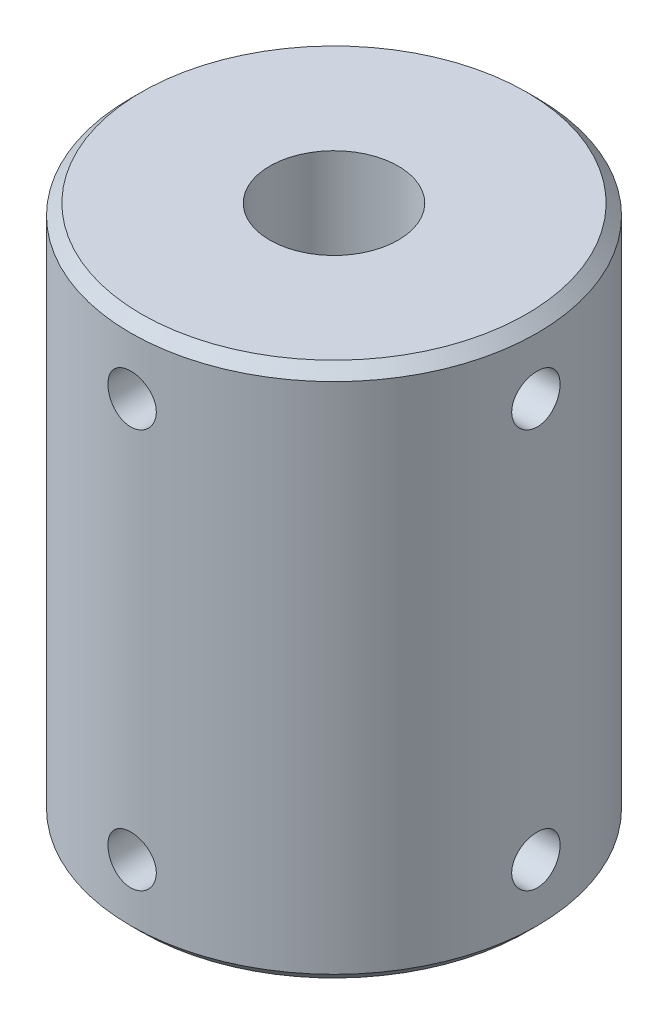
from build123d import *

# Parameters (mm, degrees)
SKETCH1_R                      = 9.5
BOSS_EXTRUDE1_DEPTH            = 25
CHAMFER1_SIZE                  = 0.508
F_6_0MM_DOWEL_HOLE1_D          = 6
SKETCH7_W                      = 1.1303
SKETCH7_H                      = 9.5
F_4_40_TAPPED_HOLE1_AT_2_COUNT = 2
F_4_40_TAPPED_HOLE1_AT_2_PITCH = 18.65
SKETCH10_W                     = 1.1303
SKETCH10_H                     = 9.5
F_4_40_TAPPED_HOLE2_AT_2_COUNT = 2
F_4_40_TAPPED_HOLE2_AT_2_PITCH = 18.65


with BuildPart() as part:
    # Sketch1 → Boss-Extrude1 (new body)
    with BuildSketch(Plane(origin=(0, 0, 0), x_dir=(1, 0, 0), z_dir=(0, 1, 0))):
        Circle(SKETCH1_R)
    extrude(amount=BOSS_EXTRUDE1_DEPTH)

    # Chamfer1
    chamfer1_edges = [part.edges().sort_by_distance(p)[0] for p in [
        (-9.5, 0, 0),
        (-9.5, 25, 0),
    ]]
    chamfer(chamfer1_edges, length=CHAMFER1_SIZE)

    # Ø6.0mm Dowel Hole1 (through all)
    with Locations(Plane(origin=(0, 25, 0), x_dir=(1, 0, 0), z_dir=(0, 1, 0))):
        with Locations((0, 0)):
            Hole(F_6_0MM_DOWEL_HOLE1_D / 2)

    # Sketch7 → #4-40 Tapped Hole1 (revolve, cut)
    with BuildSketch(Plane.ZX.offset(21.825)):
        with Locations((0.56515, 4.75)):
            Rectangle(SKETCH7_W, SKETCH7_H)
    f_4_40_tapped_hole1 = revolve(axis=Axis((-6.35, 21.825, 0), (1, 0, 0)), mode=Mode.SUBTRACT)

    # #4-40 Tapped Hole1 at 2: #4-40 Tapped Hole1 ×2
    with Locations(*[(0, -i * F_4_40_TAPPED_HOLE1_AT_2_PITCH, 0) for i in range(1, F_4_40_TAPPED_HOLE1_AT_2_COUNT)]):
        add(f_4_40_tapped_hole1, mode=Mode.SUBTRACT)

    # Sketch10 → #4-40 Tapped Hole2 (revolve, cut)
    with BuildSketch(Plane(origin=(0, 21.825, 0), x_dir=(0, 1, 0), z_dir=(1, 0, 0))):
        with Locations((0.56515, 4.75)):
            Rectangle(SKETCH10_W, SKETCH10_H)
    f_4_40_tapped_hole2 = revolve(axis=Axis((0, 21.825, -6.35), (0, 0, 1)), mode=Mode.SUBTRACT)

    # #4-40 Tapped Hole2 at 2: #4-40 Tapped Hole2 ×2
    with Locations(*[(0, -i * F_4_40_TAPPED_HOLE2_AT_2_PITCH, 0) for i in range(1, F_4_40_TAPPED_HOLE2_AT_2_COUNT)]):
        add(f_4_40_tapped_hole2, mode=Mode.SUBTRACT)


solid = part.part
